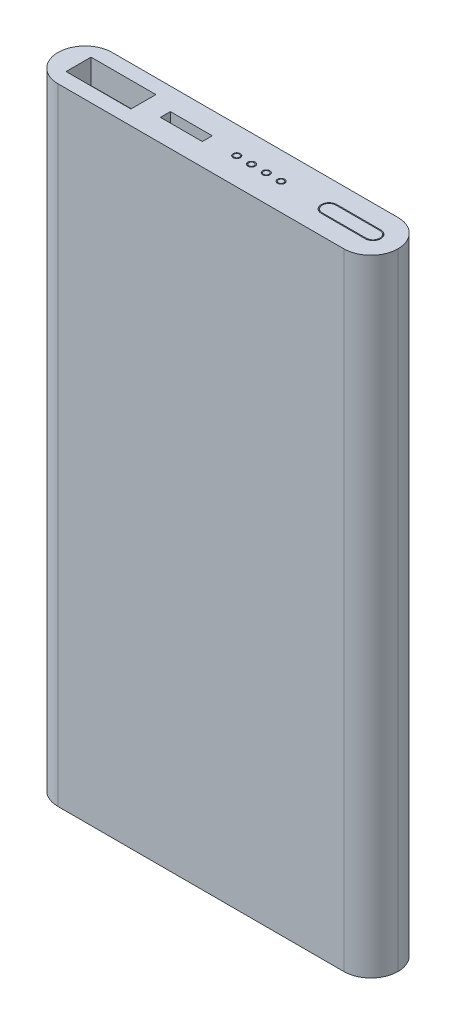
from build123d import *

# Parameters (mm, degrees)
SKETCH1_W           = 69
SKETCH1_H           = 11
BOSS_EXTRUDE1_DEPTH = 127
FILLET1_R           = 5.5
SKETCH2_R           = 0.730138729
SKETCH2_W           = 13.16276312
SKETCH2_H           = 5.0626012
SKETCH2_W_2         = 8.505170017
SKETCH2_H_2         = 2.02504048
CUT_EXTRUDE1_DEPTH  = 5
SKETCH3_R           = 0.530138729
BOSS_EXTRUDE2_DEPTH = 5


with BuildPart() as part:
    # Sketch1 → Boss-Extrude1 (new body)
    with BuildSketch(Plane(origin=(0, 0, 0), x_dir=(1, 0, 0), z_dir=(0, 1, 0))):
        with Locations((34.5, 5.5)):
            Rectangle(SKETCH1_W, SKETCH1_H)
    extrude(amount=BOSS_EXTRUDE1_DEPTH)

    # Fillet1
    fillet1_edges = [part.edges().sort_by_distance(p)[0] for p in [
        (69, 63.5, 0),
        (69, 63.5, -11),
        (0, 63.5, -11),
        (0, 63.5, 0),
    ]]
    fillet(fillet1_edges, radius=FILLET1_R - 0.0001)  # a hair under: the kernel refuses the full size

    # Sketch2 → Cut-Extrude1 (cut)
    with BuildSketch(Plane(origin=(0, 127, 0), x_dir=(1, 0, 0), z_dir=(0, 1, 0))):
        with Locations(Location((36.27191042, 5.5, 0), (0, 0, 270))):
            Circle(SKETCH2_R)
        with Locations(Location((39.27191042, 5.5, 0), (0, 0, 270))):
            Circle(SKETCH2_R)
        with Locations(Location((42.27191042, 5.5, 0), (0, 0, 270))):
            Circle(SKETCH2_R)
        with Locations(Location((45.27191042, 5.5, 0), (0, 0, 270))):
            Circle(SKETCH2_R)
        with Locations((10.756400371, 5.5)):
            Rectangle(SKETCH2_W, SKETCH2_H)
        with Locations((26.045455995, 5.5)):
            Rectangle(SKETCH2_W_2, SKETCH2_H_2)
        with BuildLine():
            Line((55.003534861, 7.069406372), (63.913712973, 7.069406372))
            ThreePointArc((63.913712973, 7.069406372), (65.483119345, 5.5), (63.913712973, 3.930593628))
            Line((63.913712973, 3.930593628), (55.003534861, 3.930593628))
            ThreePointArc((55.003534861, 3.930593628), (53.434128489, 5.5), (55.003534861, 7.069406372))
        make_face()
    extrude(amount=-CUT_EXTRUDE1_DEPTH, mode=Mode.SUBTRACT)

    # Sketch3 → Boss-Extrude2 (add)
    with BuildSketch(Plane(origin=(0, 122, 0), x_dir=(1, 0, 0), z_dir=(0, 1, 0))):
        with Locations(Location((36.27191042, 5.5, 0), (0, 0, 90))):
            Circle(SKETCH3_R)
        with Locations(Location((39.27191042, 5.5, 0), (0, 0, 90))):
            Circle(SKETCH3_R)
        with Locations(Location((42.27191042, 5.5, 0), (0, 0, 90))):
            Circle(SKETCH3_R)
        with Locations(Location((45.27191042, 5.5, 0), (0, 0, 90))):
            Circle(SKETCH3_R)
        with BuildLine():
            Line((55.003534861, 4.130593628), (63.913712973, 4.130593628))
            ThreePointArc((63.913712973, 4.130593628), (65.283119345, 5.5), (63.913712973, 6.869406372))
            Line((63.913712973, 6.869406372), (55.003534861, 6.869406372))
            ThreePointArc((55.003534861, 6.869406372), (53.634128489, 5.5), (55.003534861, 4.130593628))
        make_face()
    extrude(amount=BOSS_EXTRUDE2_DEPTH)


solid = part.part
